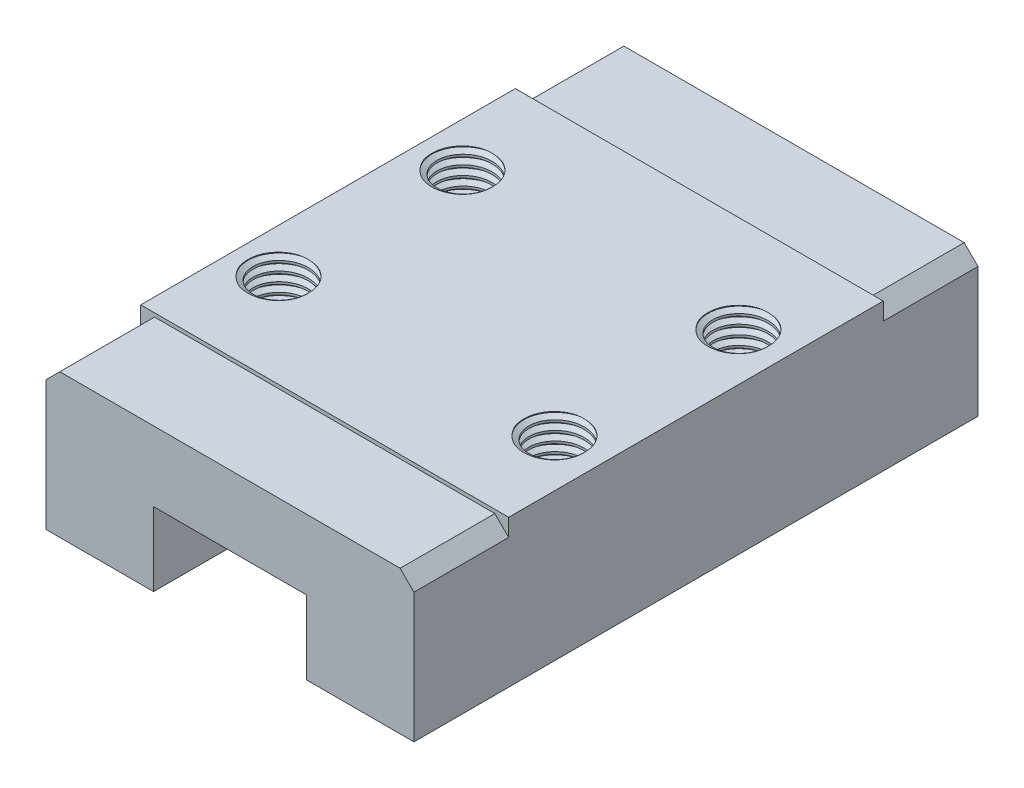
from build123d import *

# Parameters (mm, degrees)
BOSS_EXTRUDE1_DEPTH = 30.66
SKETCH2_R           = 1.5
CUT_EXTRUDE1_DEPTH  = 6
SKETCH3_W           = 20
SKETCH3_H           = 0.2
CUT_EXTRUDE2_DEPTH  = 5.15
SKETCH4_W           = 20
SKETCH4_H           = 0.2
CUT_EXTRUDE3_DEPTH  = 5.15
CHAMFER1_SIZE       = 0.75
THREAD1_PITCH       = 0.5
THREAD2_PITCH       = 0.5
THREAD3_PITCH       = 0.5
THREAD4_PITCH       = 0.5


with BuildPart() as part:
    # Sketch1 → Boss-Extrude1 (new body)
    with BuildSketch(Plane.XY):
        Polygon((-10, 0), (10, 0), (10, -8), (4.15, -8), (4.15, -4), (-4.15, -4), (-4.15, -8), (-10, -8), align=None)
    extrude(amount=BOSS_EXTRUDE1_DEPTH)

    # Sketch2 → Cut-Extrude1 (cut)
    with BuildSketch(Plane(origin=(0, 0, 0), x_dir=(1, 0, 0), z_dir=(0, 1, 0))):
        with Locations(Location((-7.5, -10.33, 0), (0, 0, 270))):
            Circle(SKETCH2_R)
        with Locations(Location((7.5, -10.33, 0), (0, 0, 270))):
            Circle(SKETCH2_R)
        with Locations(Location((7.5, -20.33, 0), (0, 0, 270))):
            Circle(SKETCH2_R)
        with Locations(Location((-7.5, -20.33, 0), (0, 0, 270))):
            Circle(SKETCH2_R)
    extrude(amount=-CUT_EXTRUDE1_DEPTH, mode=Mode.SUBTRACT)

    # Sketch3 → Cut-Extrude2 (cut)
    with BuildSketch(Plane.XY.offset(30.66)):
        with Locations((0, -0.1)):
            Rectangle(SKETCH3_W, SKETCH3_H)
    extrude(amount=-CUT_EXTRUDE2_DEPTH, mode=Mode.SUBTRACT)

    # Sketch4 → Cut-Extrude3 (cut)
    with BuildSketch(Plane(origin=(0, 0, 0), x_dir=(-1, 0, 0), z_dir=(0, 0, -1))):
        with Locations((0, -0.1)):
            Rectangle(SKETCH4_W, SKETCH4_H)
    extrude(amount=-CUT_EXTRUDE3_DEPTH, mode=Mode.SUBTRACT)

    # Chamfer1
    chamfer1_edges = [part.edges().sort_by_distance(p)[0] for p in [
        (10, -0.2, 28.085),
        (-10, -0.2, 28.085),
        (10, -0.2, 2.575),
        (-10, -0.2, 2.575),
    ]]
    chamfer(chamfer1_edges, length=CHAMFER1_SIZE)

    # Thread1: the profile of Thread Profile1 profile screwed along a right-hand helix of 12 turns, 6 arcs to a turn; built about Z, then put on its axis
    thread1_z = Axis((0, 0, 0), (0, 0, 1))
    thread1_corners = [(1.4997, 0, -0.000173205), (1.770632938, 0, 0.156249999), (1.770632938, 0, 0.218749999), (1.4997, 0, 0.375173204)]
    with BuildLine(mode=Mode.PRIVATE) as thread1_profile:
        Line(thread1_corners[0], thread1_corners[1])
        Line(thread1_corners[1], thread1_corners[2])
        Line(thread1_corners[2], thread1_corners[3])
        Line(thread1_corners[3], thread1_corners[0])
    thread1_cap = Face(thread1_profile.wire())
    thread1_turn_angles = [0, 30, 60, 90, 120, 150, 180, 210, 240, 270, 300, 330, 360]
    thread1_turn_weights = [1, 0.8660254037844387, 1, 0.8660254037844387, 1, 0.8660254037844387, 1, 0.8660254037844387, 1, 0.8660254037844387, 1, 0.8660254037844387, 1]
    thread1_turn_rails = [Edge.make_bspline([Vector(p[0], p[1], 0).rotate(thread1_z, thread1_turn_angles[k]) / thread1_turn_weights[k] + Vector(0, 0, p[2] + THREAD1_PITCH * thread1_turn_angles[k] / 360) for k in range(13)], [0, 0, 0, 1, 1, 2, 2, 3, 3, 4, 4, 5, 5, 6, 6, 6], 2, thread1_turn_weights) for p in thread1_corners]
    thread1_turn_sides = [Face.make_surface_from_curves(thread1_turn_rails[p[0]], thread1_turn_rails[p[1]]) for p in [(0, 1), (1, 2), (2, 3), (3, 0)]]
    thread1 = Plane(origin=(7.5, -6, 10.33), x_dir=(1, 0, 0), z_dir=(0, 1, 0)) * Solid(Shell([*[p.moved(Location((0, 0, THREAD1_PITCH * i))) for i in range(12) for p in thread1_turn_sides], thread1_cap, thread1_cap.rotate(thread1_z, 4320).moved(Location((0, 0, THREAD1_PITCH * 4320 / 360)))]))
    add(thread1, mode=Mode.SUBTRACT)

    # Thread2: the profile of Thread Profile2 profile screwed along a right-hand helix of 12 turns, 6 arcs to a turn; built about Z, then put on its axis
    thread2_z = Axis((0, 0, 0), (0, 0, 1))
    thread2_corners = [(1.4997, 0, -0.000173205), (1.770632938, 0, 0.156249999), (1.770632938, 0, 0.218749999), (1.4997, 0, 0.375173204)]
    with BuildLine(mode=Mode.PRIVATE) as thread2_profile:
        Line(thread2_corners[0], thread2_corners[1])
        Line(thread2_corners[1], thread2_corners[2])
        Line(thread2_corners[2], thread2_corners[3])
        Line(thread2_corners[3], thread2_corners[0])
    thread2_cap = Face(thread2_profile.wire())
    thread2_turn_angles = [0, 30, 60, 90, 120, 150, 180, 210, 240, 270, 300, 330, 360]
    thread2_turn_weights = [1, 0.8660254037844387, 1, 0.8660254037844387, 1, 0.8660254037844387, 1, 0.8660254037844387, 1, 0.8660254037844387, 1, 0.8660254037844387, 1]
    thread2_turn_rails = [Edge.make_bspline([Vector(p[0], p[1], 0).rotate(thread2_z, thread2_turn_angles[k]) / thread2_turn_weights[k] + Vector(0, 0, p[2] + THREAD2_PITCH * thread2_turn_angles[k] / 360) for k in range(13)], [0, 0, 0, 1, 1, 2, 2, 3, 3, 4, 4, 5, 5, 6, 6, 6], 2, thread2_turn_weights) for p in thread2_corners]
    thread2_turn_sides = [Face.make_surface_from_curves(thread2_turn_rails[p[0]], thread2_turn_rails[p[1]]) for p in [(0, 1), (1, 2), (2, 3), (3, 0)]]
    thread2 = Plane(origin=(7.5, -6, 20.33), x_dir=(1, 0, 0), z_dir=(0, 1, 0)) * Solid(Shell([*[p.moved(Location((0, 0, THREAD2_PITCH * i))) for i in range(12) for p in thread2_turn_sides], thread2_cap, thread2_cap.rotate(thread2_z, 4320).moved(Location((0, 0, THREAD2_PITCH * 4320 / 360)))]))
    add(thread2, mode=Mode.SUBTRACT)

    # Thread3: the profile of Thread Profile3 profile screwed along a right-hand helix of 12 turns, 6 arcs to a turn; built about Z, then put on its axis
    thread3_z = Axis((0, 0, 0), (0, 0, 1))
    thread3_corners = [(1.4997, 0, -0.000173205), (1.770632938, 0, 0.156249999), (1.770632938, 0, 0.218749999), (1.4997, 0, 0.375173204)]
    with BuildLine(mode=Mode.PRIVATE) as thread3_profile:
        Line(thread3_corners[0], thread3_corners[1])
        Line(thread3_corners[1], thread3_corners[2])
        Line(thread3_corners[2], thread3_corners[3])
        Line(thread3_corners[3], thread3_corners[0])
    thread3_cap = Face(thread3_profile.wire())
    thread3_turn_angles = [0, 30, 60, 90, 120, 150, 180, 210, 240, 270, 300, 330, 360]
    thread3_turn_weights = [1, 0.8660254037844387, 1, 0.8660254037844387, 1, 0.8660254037844387, 1, 0.8660254037844387, 1, 0.8660254037844387, 1, 0.8660254037844387, 1]
    thread3_turn_rails = [Edge.make_bspline([Vector(p[0], p[1], 0).rotate(thread3_z, thread3_turn_angles[k]) / thread3_turn_weights[k] + Vector(0, 0, p[2] + THREAD3_PITCH * thread3_turn_angles[k] / 360) for k in range(13)], [0, 0, 0, 1, 1, 2, 2, 3, 3, 4, 4, 5, 5, 6, 6, 6], 2, thread3_turn_weights) for p in thread3_corners]
    thread3_turn_sides = [Face.make_surface_from_curves(thread3_turn_rails[p[0]], thread3_turn_rails[p[1]]) for p in [(0, 1), (1, 2), (2, 3), (3, 0)]]
    thread3 = Plane(origin=(-7.5, -6, 10.33), x_dir=(1, 0, 0), z_dir=(0, 1, 0)) * Solid(Shell([*[p.moved(Location((0, 0, THREAD3_PITCH * i))) for i in range(12) for p in thread3_turn_sides], thread3_cap, thread3_cap.rotate(thread3_z, 4320).moved(Location((0, 0, THREAD3_PITCH * 4320 / 360)))]))
    add(thread3, mode=Mode.SUBTRACT)

    # Thread4: the profile of Thread Profile4 profile screwed along a right-hand helix of 12 turns, 6 arcs to a turn; built about Z, then put on its axis
    thread4_z = Axis((0, 0, 0), (0, 0, 1))
    thread4_corners = [(1.4997, 0, -0.000173205), (1.770632938, 0, 0.156249999), (1.770632938, 0, 0.218749999), (1.4997, 0, 0.375173204)]
    with BuildLine(mode=Mode.PRIVATE) as thread4_profile:
        Line(thread4_corners[0], thread4_corners[1])
        Line(thread4_corners[1], thread4_corners[2])
        Line(thread4_corners[2], thread4_corners[3])
        Line(thread4_corners[3], thread4_corners[0])
    thread4_cap = Face(thread4_profile.wire())
    thread4_turn_angles = [0, 30, 60, 90, 120, 150, 180, 210, 240, 270, 300, 330, 360]
    thread4_turn_weights = [1, 0.8660254037844387, 1, 0.8660254037844387, 1, 0.8660254037844387, 1, 0.8660254037844387, 1, 0.8660254037844387, 1, 0.8660254037844387, 1]
    thread4_turn_rails = [Edge.make_bspline([Vector(p[0], p[1], 0).rotate(thread4_z, thread4_turn_angles[k]) / thread4_turn_weights[k] + Vector(0, 0, p[2] + THREAD4_PITCH * thread4_turn_angles[k] / 360) for k in range(13)], [0, 0, 0, 1, 1, 2, 2, 3, 3, 4, 4, 5, 5, 6, 6, 6], 2, thread4_turn_weights) for p in thread4_corners]
    thread4_turn_sides = [Face.make_surface_from_curves(thread4_turn_rails[p[0]], thread4_turn_rails[p[1]]) for p in [(0, 1), (1, 2), (2, 3), (3, 0)]]
    thread4 = Plane(origin=(-7.5, -6, 20.33), x_dir=(1, 0, 0), z_dir=(0, 1, 0)) * Solid(Shell([*[p.moved(Location((0, 0, THREAD4_PITCH * i))) for i in range(12) for p in thread4_turn_sides], thread4_cap, thread4_cap.rotate(thread4_z, 4320).moved(Location((0, 0, THREAD4_PITCH * 4320 / 360)))]))
    add(thread4, mode=Mode.SUBTRACT)


solid = part.part
